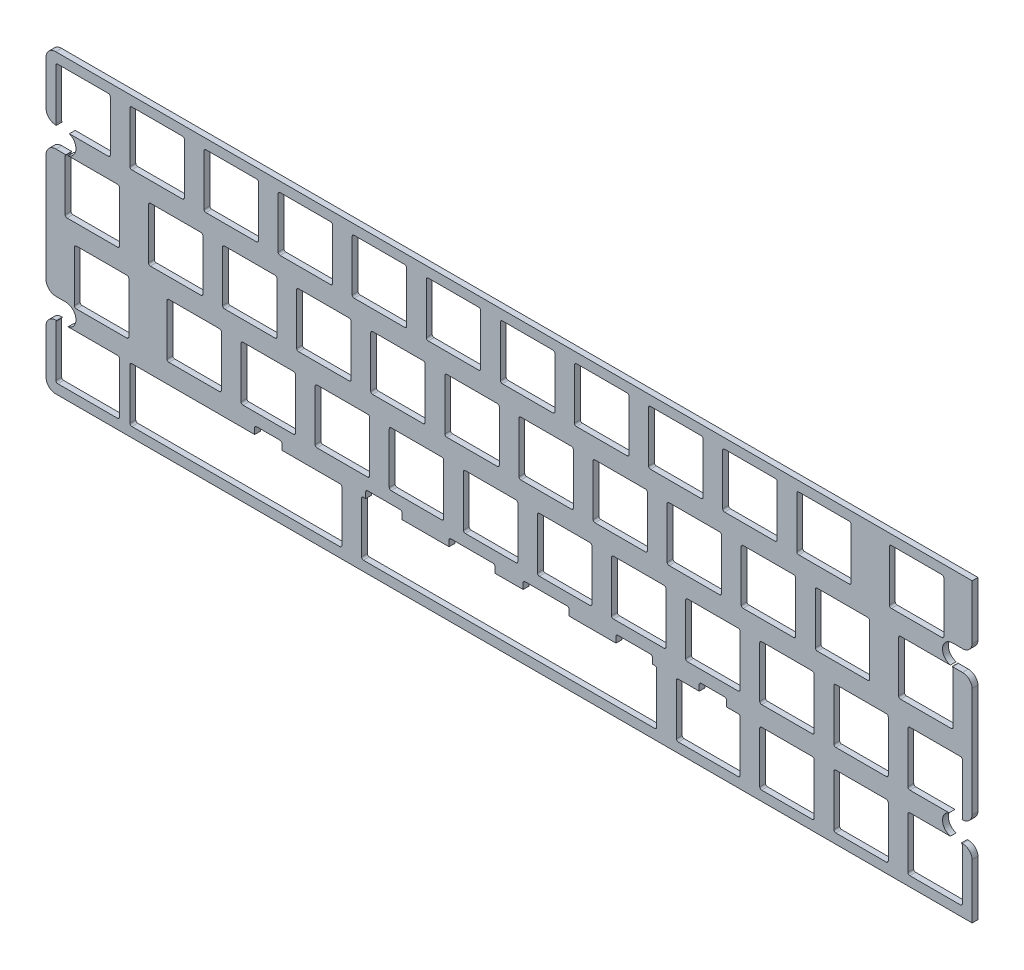
from build123d import *

# Parameters (mm, degrees)
BOSS_EXTRUDE1_DEPTH = 1.5
CUT_EXTRUDE1_DEPTH  = 1.5


with BuildPart() as part:
    # Model → Boss-Extrude1 (new body)
    with BuildSketch(Plane.XY):
        with BuildLine():
            Line((238.125, 0), (2.5, 0))
            ThreePointArc((2.5, 0), (0.732233047, -0.732233047), (0, -2.5))
            Line((0, -2.5), (0, -73.7))
            ThreePointArc((0, -73.7), (0.732233047, -75.467766953), (2.5, -76.2))
            Line((2.5, -76.2), (238.125, -76.2))
            Line((238.125, -76.2), (238.125, 0))
        make_face()
        with BuildLine():
            ThreePointArc((2.525, -60.175), (2.671446609, -59.821446609), (3.025, -59.675))
            Line((3.025, -59.675), (5.40625, -59.675))
            Line((5.40625, -59.675), (16.025, -59.675))
            Line((16.025, -59.675), (18.40625, -59.675))
            ThreePointArc((18.40625, -59.675), (18.759803391, -59.821446609), (18.90625, -60.175))
            Line((18.90625, -60.175), (18.90625, -73.175))
            ThreePointArc((18.90625, -73.175), (18.759803391, -73.528553391), (18.40625, -73.675))
            Line((18.40625, -73.675), (16.025, -73.675))
            Line((16.025, -73.675), (5.40625, -73.675))
            Line((5.40625, -73.675), (3.025, -73.675))
            ThreePointArc((3.025, -73.675), (2.671446609, -73.528553391), (2.525, -73.175))
            Line((2.525, -73.175), (2.525, -60.175))
        make_face(mode=Mode.SUBTRACT)
        with BuildLine():
            Line((62.55625, -73.675), (60.175, -73.675))
            Line((60.175, -73.675), (54.125, -73.675))
            Line((54.125, -73.675), (42.21875, -73.675))
            Line((42.21875, -73.675), (41.125, -73.675))
            Line((41.125, -73.675), (35.075, -73.675))
            Line((35.075, -73.675), (29.21875, -73.675))
            Line((29.21875, -73.675), (22.075, -73.675))
            ThreePointArc((22.075, -73.675), (21.721446609, -73.528553391), (21.575, -73.175))
            Line((21.575, -73.175), (21.575, -60.175))
            ThreePointArc((21.575, -60.175), (21.721446609, -59.821446609), (22.075, -59.675))
            Line((22.075, -59.675), (29.21875, -59.675))
            Line((29.21875, -59.675), (35.075, -59.675))
            Line((35.075, -59.675), (41.125, -59.675))
            Line((41.125, -59.675), (42.21875, -59.675))
            Line((42.21875, -59.675), (53.65, -59.675))
            Line((53.65, -59.675), (53.65, -58.175))
            ThreePointArc((53.65, -58.175), (53.796446609, -57.821446609), (54.15, -57.675))
            Line((54.15, -57.675), (60.15, -57.675))
            ThreePointArc((60.15, -57.675), (60.503553391, -57.821446609), (60.65, -58.175))
            Line((60.65, -58.175), (60.65, -59.675))
            Line((60.65, -59.675), (62.55625, -59.675))
            Line((62.55625, -59.675), (73.175, -59.675))
            Line((73.175, -59.675), (75.55625, -59.675))
            ThreePointArc((75.55625, -59.675), (75.909803391, -59.821446609), (76.05625, -60.175))
            Line((76.05625, -60.175), (76.05625, -73.175))
            ThreePointArc((76.05625, -73.175), (75.909803391, -73.528553391), (75.55625, -73.675))
            Line((75.55625, -73.675), (73.175, -73.675))
            Line((73.175, -73.675), (62.55625, -73.675))
        make_face(mode=Mode.SUBTRACT)
        with BuildLine():
            ThreePointArc((7.2875, -41.125), (7.433946609, -40.771446609), (7.7875, -40.625))
            Line((7.7875, -40.625), (20.7875, -40.625))
            ThreePointArc((20.7875, -40.625), (21.141053391, -40.771446609), (21.2875, -41.125))
            Line((21.2875, -41.125), (21.2875, -54.125))
            ThreePointArc((21.2875, -54.125), (21.141053391, -54.478553391), (20.7875, -54.625))
            Line((20.7875, -54.625), (7.7875, -54.625))
            ThreePointArc((7.7875, -54.625), (7.433946609, -54.478553391), (7.2875, -54.125))
            Line((7.2875, -54.125), (7.2875, -41.125))
        make_face(mode=Mode.SUBTRACT)
        with BuildLine():
            ThreePointArc((31.1, -41.125), (31.246446609, -40.771446609), (31.6, -40.625))
            Line((31.6, -40.625), (44.6, -40.625))
            ThreePointArc((44.6, -40.625), (44.953553391, -40.771446609), (45.1, -41.125))
            Line((45.1, -41.125), (45.1, -54.125))
            ThreePointArc((45.1, -54.125), (44.953553391, -54.478553391), (44.6, -54.625))
            Line((44.6, -54.625), (31.6, -54.625))
            ThreePointArc((31.6, -54.625), (31.246446609, -54.478553391), (31.1, -54.125))
            Line((31.1, -54.125), (31.1, -41.125))
        make_face(mode=Mode.SUBTRACT)
        with BuildLine():
            ThreePointArc((50.15, -41.125), (50.296446609, -40.771446609), (50.65, -40.625))
            Line((50.65, -40.625), (63.65, -40.625))
            ThreePointArc((63.65, -40.625), (64.003553391, -40.771446609), (64.15, -41.125))
            Line((64.15, -41.125), (64.15, -54.125))
            ThreePointArc((64.15, -54.125), (64.003553391, -54.478553391), (63.65, -54.625))
            Line((63.65, -54.625), (50.65, -54.625))
            ThreePointArc((50.65, -54.625), (50.296446609, -54.478553391), (50.15, -54.125))
            Line((50.15, -54.125), (50.15, -41.125))
        make_face(mode=Mode.SUBTRACT)
        with BuildLine():
            ThreePointArc((69.2, -41.125), (69.346446609, -40.771446609), (69.7, -40.625))
            Line((69.7, -40.625), (82.7, -40.625))
            ThreePointArc((82.7, -40.625), (83.053553391, -40.771446609), (83.2, -41.125))
            Line((83.2, -41.125), (83.2, -54.125))
            ThreePointArc((83.2, -54.125), (83.053553391, -54.478553391), (82.7, -54.625))
            Line((82.7, -54.625), (69.7, -54.625))
            ThreePointArc((69.7, -54.625), (69.346446609, -54.478553391), (69.2, -54.125))
            Line((69.2, -54.125), (69.2, -41.125))
        make_face(mode=Mode.SUBTRACT)
        with BuildLine():
            ThreePointArc((88.25, -41.125), (88.396446609, -40.771446609), (88.75, -40.625))
            Line((88.75, -40.625), (101.75, -40.625))
            ThreePointArc((101.75, -40.625), (102.103553391, -40.771446609), (102.25, -41.125))
            Line((102.25, -41.125), (102.25, -54.125))
            ThreePointArc((102.25, -54.125), (102.103553391, -54.478553391), (101.75, -54.625))
            Line((101.75, -54.625), (88.75, -54.625))
            ThreePointArc((88.75, -54.625), (88.396446609, -54.478553391), (88.25, -54.125))
            Line((88.25, -54.125), (88.25, -41.125))
        make_face(mode=Mode.SUBTRACT)
        with BuildLine():
            ThreePointArc((107.3, -41.125), (107.446446609, -40.771446609), (107.8, -40.625))
            Line((107.8, -40.625), (120.8, -40.625))
            ThreePointArc((120.8, -40.625), (121.153553391, -40.771446609), (121.3, -41.125))
            Line((121.3, -41.125), (121.3, -54.125))
            ThreePointArc((121.3, -54.125), (121.153553391, -54.478553391), (120.8, -54.625))
            Line((120.8, -54.625), (107.8, -54.625))
            ThreePointArc((107.8, -54.625), (107.446446609, -54.478553391), (107.3, -54.125))
            Line((107.3, -54.125), (107.3, -41.125))
        make_face(mode=Mode.SUBTRACT)
        with BuildLine():
            Line((91.5745, -58.175), (91.5745, -59.675))
            Line((91.5745, -59.675), (93.5125, -59.675))
            Line((93.5125, -59.675), (94.60625, -59.675))
            Line((94.60625, -59.675), (103.6245, -59.675))
            Line((103.6245, -59.675), (103.6245, -58.175))
            ThreePointArc((103.6245, -58.175), (103.770946609, -57.821446609), (104.1245, -57.675))
            Line((104.1245, -57.675), (106.56925, -57.675))
            Line((106.56925, -57.675), (108.9505, -57.675))
            Line((108.9505, -57.675), (110.1245, -57.675))
            Line((110.1245, -57.675), (112.56925, -57.675))
            Line((112.56925, -57.675), (114.9505, -57.675))
            ThreePointArc((114.9505, -57.675), (115.304053391, -57.821446609), (115.4505, -58.175))
            Line((115.4505, -58.175), (115.4505, -59.675))
            Line((115.4505, -59.675), (120.8, -59.675))
            Line((120.8, -59.675), (122.6745, -59.675))
            Line((122.6745, -59.675), (122.6745, -58.175))
            ThreePointArc((122.6745, -58.175), (122.820946609, -57.821446609), (123.1745, -57.675))
            Line((123.1745, -57.675), (125.55575, -57.675))
            Line((125.55575, -57.675), (128.0005, -57.675))
            Line((128.0005, -57.675), (129.1745, -57.675))
            Line((129.1745, -57.675), (131.55575, -57.675))
            Line((131.55575, -57.675), (134.0005, -57.675))
            ThreePointArc((134.0005, -57.675), (134.354053391, -57.821446609), (134.5005, -58.175))
            Line((134.5005, -58.175), (134.5005, -59.675))
            Line((134.5005, -59.675), (143.51875, -59.675))
            Line((143.51875, -59.675), (144.6125, -59.675))
            Line((144.6125, -59.675), (146.5505, -59.675))
            Line((146.5505, -59.675), (146.5505, -58.175))
            ThreePointArc((146.5505, -58.175), (146.696946609, -57.821446609), (147.0505, -57.675))
            Line((147.0505, -57.675), (149.43175, -57.675))
            Line((149.43175, -57.675), (153.0505, -57.675))
            Line((153.0505, -57.675), (155.43175, -57.675))
            ThreePointArc((155.43175, -57.675), (155.785303391, -57.821446609), (155.93175, -58.175))
            Line((155.93175, -58.175), (155.93175, -59.675))
            Line((155.93175, -59.675), (156.51875, -59.675))
            ThreePointArc((156.51875, -59.675), (156.872303391, -59.821446609), (157.01875, -60.175))
            Line((157.01875, -60.175), (157.01875, -73.175))
            ThreePointArc((157.01875, -73.175), (156.872303391, -73.528553391), (156.51875, -73.675))
            Line((156.51875, -73.675), (146.99375, -73.675))
            Line((146.99375, -73.675), (144.6125, -73.675))
            Line((144.6125, -73.675), (143.51875, -73.675))
            Line((143.51875, -73.675), (133.99375, -73.675))
            Line((133.99375, -73.675), (131.6125, -73.675))
            Line((131.6125, -73.675), (125.5625, -73.675))
            Line((125.5625, -73.675), (120.8, -73.675))
            Line((120.8, -73.675), (112.5625, -73.675))
            Line((112.5625, -73.675), (107.8, -73.675))
            Line((107.8, -73.675), (106.5125, -73.675))
            Line((106.5125, -73.675), (104.13125, -73.675))
            Line((104.13125, -73.675), (94.60625, -73.675))
            Line((94.60625, -73.675), (93.5125, -73.675))
            Line((93.5125, -73.675), (91.13125, -73.675))
            Line((91.13125, -73.675), (81.60625, -73.675))
            ThreePointArc((81.60625, -73.675), (81.252696609, -73.528553391), (81.10625, -73.175))
            Line((81.10625, -73.175), (81.10625, -60.175))
            ThreePointArc((81.10625, -60.175), (81.252696609, -59.821446609), (81.60625, -59.675))
            Line((81.60625, -59.675), (82.19325, -59.675))
            Line((82.19325, -59.675), (82.19325, -58.175))
            ThreePointArc((82.19325, -58.175), (82.339696609, -57.821446609), (82.69325, -57.675))
            Line((82.69325, -57.675), (85.0745, -57.675))
            Line((85.0745, -57.675), (88.69325, -57.675))
            Line((88.69325, -57.675), (91.0745, -57.675))
            ThreePointArc((91.0745, -57.675), (91.428053391, -57.821446609), (91.5745, -58.175))
        make_face(mode=Mode.SUBTRACT)
        with BuildLine():
            Line((168.45, -57.675), (174.45, -57.675))
            ThreePointArc((174.45, -57.675), (174.803553391, -57.821446609), (174.95, -58.175))
            Line((174.95, -58.175), (174.95, -59.675))
            Line((174.95, -59.675), (175.56875, -59.675))
            Line((175.56875, -59.675), (177.95, -59.675))
            ThreePointArc((177.95, -59.675), (178.303553391, -59.821446609), (178.45, -60.175))
            Line((178.45, -60.175), (178.45, -73.175))
            ThreePointArc((178.45, -73.175), (178.303553391, -73.528553391), (177.95, -73.675))
            Line((177.95, -73.675), (175.56875, -73.675))
            Line((175.56875, -73.675), (164.95, -73.675))
            Line((164.95, -73.675), (162.56875, -73.675))
            ThreePointArc((162.56875, -73.675), (162.215196609, -73.528553391), (162.06875, -73.175))
            Line((162.06875, -73.175), (162.06875, -60.175))
            ThreePointArc((162.06875, -60.175), (162.215196609, -59.821446609), (162.56875, -59.675))
            Line((162.56875, -59.675), (164.95, -59.675))
            Line((164.95, -59.675), (167.95, -59.675))
            Line((167.95, -59.675), (167.95, -58.175))
            ThreePointArc((167.95, -58.175), (168.096446609, -57.821446609), (168.45, -57.675))
        make_face(mode=Mode.SUBTRACT)
        with BuildLine():
            ThreePointArc((183.5, -60.175), (183.646446609, -59.821446609), (184, -59.675))
            Line((184, -59.675), (197, -59.675))
            ThreePointArc((197, -59.675), (197.353553391, -59.821446609), (197.5, -60.175))
            Line((197.5, -60.175), (197.5, -73.175))
            ThreePointArc((197.5, -73.175), (197.353553391, -73.528553391), (197, -73.675))
            Line((197, -73.675), (184, -73.675))
            ThreePointArc((184, -73.675), (183.646446609, -73.528553391), (183.5, -73.175))
            Line((183.5, -73.175), (183.5, -60.175))
        make_face(mode=Mode.SUBTRACT)
        with BuildLine():
            ThreePointArc((202.55, -60.175), (202.696446609, -59.821446609), (203.05, -59.675))
            Line((203.05, -59.675), (216.05, -59.675))
            ThreePointArc((216.05, -59.675), (216.403553391, -59.821446609), (216.55, -60.175))
            Line((216.55, -60.175), (216.55, -73.175))
            ThreePointArc((216.55, -73.175), (216.403553391, -73.528553391), (216.05, -73.675))
            Line((216.05, -73.675), (203.05, -73.675))
            ThreePointArc((203.05, -73.675), (202.696446609, -73.528553391), (202.55, -73.175))
            Line((202.55, -73.175), (202.55, -60.175))
        make_face(mode=Mode.SUBTRACT)
        with BuildLine():
            ThreePointArc((221.6, -60.175), (221.746446609, -59.821446609), (222.1, -59.675))
            Line((222.1, -59.675), (235.1, -59.675))
            ThreePointArc((235.1, -59.675), (235.453553391, -59.821446609), (235.6, -60.175))
            Line((235.6, -60.175), (235.6, -73.175))
            ThreePointArc((235.6, -73.175), (235.453553391, -73.528553391), (235.1, -73.675))
            Line((235.1, -73.675), (222.1, -73.675))
            ThreePointArc((222.1, -73.675), (221.746446609, -73.528553391), (221.6, -73.175))
            Line((221.6, -73.175), (221.6, -60.175))
        make_face(mode=Mode.SUBTRACT)
        with BuildLine():
            ThreePointArc((126.35, -41.125), (126.496446609, -40.771446609), (126.85, -40.625))
            Line((126.85, -40.625), (139.85, -40.625))
            ThreePointArc((139.85, -40.625), (140.203553391, -40.771446609), (140.35, -41.125))
            Line((140.35, -41.125), (140.35, -54.125))
            ThreePointArc((140.35, -54.125), (140.203553391, -54.478553391), (139.85, -54.625))
            Line((139.85, -54.625), (126.85, -54.625))
            ThreePointArc((126.85, -54.625), (126.496446609, -54.478553391), (126.35, -54.125))
            Line((126.35, -54.125), (126.35, -41.125))
        make_face(mode=Mode.SUBTRACT)
        with BuildLine():
            ThreePointArc((145.4, -41.125), (145.546446609, -40.771446609), (145.9, -40.625))
            Line((145.9, -40.625), (158.9, -40.625))
            ThreePointArc((158.9, -40.625), (159.253553391, -40.771446609), (159.4, -41.125))
            Line((159.4, -41.125), (159.4, -54.125))
            ThreePointArc((159.4, -54.125), (159.253553391, -54.478553391), (158.9, -54.625))
            Line((158.9, -54.625), (145.9, -54.625))
            ThreePointArc((145.9, -54.625), (145.546446609, -54.478553391), (145.4, -54.125))
            Line((145.4, -54.125), (145.4, -41.125))
        make_face(mode=Mode.SUBTRACT)
        with BuildLine():
            ThreePointArc((164.45, -41.125), (164.596446609, -40.771446609), (164.95, -40.625))
            Line((164.95, -40.625), (177.95, -40.625))
            ThreePointArc((177.95, -40.625), (178.303553391, -40.771446609), (178.45, -41.125))
            Line((178.45, -41.125), (178.45, -54.125))
            ThreePointArc((178.45, -54.125), (178.303553391, -54.478553391), (177.95, -54.625))
            Line((177.95, -54.625), (164.95, -54.625))
            ThreePointArc((164.95, -54.625), (164.596446609, -54.478553391), (164.45, -54.125))
            Line((164.45, -54.125), (164.45, -41.125))
        make_face(mode=Mode.SUBTRACT)
        with BuildLine():
            ThreePointArc((183.5, -41.125), (183.646446609, -40.771446609), (184, -40.625))
            Line((184, -40.625), (197, -40.625))
            ThreePointArc((197, -40.625), (197.353553391, -40.771446609), (197.5, -41.125))
            Line((197.5, -41.125), (197.5, -54.125))
            ThreePointArc((197.5, -54.125), (197.353553391, -54.478553391), (197, -54.625))
            Line((197, -54.625), (184, -54.625))
            ThreePointArc((184, -54.625), (183.646446609, -54.478553391), (183.5, -54.125))
            Line((183.5, -54.125), (183.5, -41.125))
        make_face(mode=Mode.SUBTRACT)
        with BuildLine():
            ThreePointArc((202.55, -41.125), (202.696446609, -40.771446609), (203.05, -40.625))
            Line((203.05, -40.625), (216.05, -40.625))
            ThreePointArc((216.05, -40.625), (216.403553391, -40.771446609), (216.55, -41.125))
            Line((216.55, -41.125), (216.55, -54.125))
            ThreePointArc((216.55, -54.125), (216.403553391, -54.478553391), (216.05, -54.625))
            Line((216.05, -54.625), (203.05, -54.625))
            ThreePointArc((203.05, -54.625), (202.696446609, -54.478553391), (202.55, -54.125))
            Line((202.55, -54.125), (202.55, -41.125))
        make_face(mode=Mode.SUBTRACT)
        with BuildLine():
            ThreePointArc((221.6, -41.125), (221.746446609, -40.771446609), (222.1, -40.625))
            Line((222.1, -40.625), (235.1, -40.625))
            ThreePointArc((235.1, -40.625), (235.453553391, -40.771446609), (235.6, -41.125))
            Line((235.6, -41.125), (235.6, -54.125))
            ThreePointArc((235.6, -54.125), (235.453553391, -54.478553391), (235.1, -54.625))
            Line((235.1, -54.625), (222.1, -54.625))
            ThreePointArc((222.1, -54.625), (221.746446609, -54.478553391), (221.6, -54.125))
            Line((221.6, -54.125), (221.6, -41.125))
        make_face(mode=Mode.SUBTRACT)
        with BuildLine():
            ThreePointArc((4.90625, -22.075), (5.052696609, -21.721446609), (5.40625, -21.575))
            Line((5.40625, -21.575), (18.40625, -21.575))
            ThreePointArc((18.40625, -21.575), (18.759803391, -21.721446609), (18.90625, -22.075))
            Line((18.90625, -22.075), (18.90625, -35.075))
            ThreePointArc((18.90625, -35.075), (18.759803391, -35.428553391), (18.40625, -35.575))
            Line((18.40625, -35.575), (5.40625, -35.575))
            ThreePointArc((5.40625, -35.575), (5.052696609, -35.428553391), (4.90625, -35.075))
            Line((4.90625, -35.075), (4.90625, -22.075))
        make_face(mode=Mode.SUBTRACT)
        with BuildLine():
            ThreePointArc((26.3375, -22.075), (26.483946609, -21.721446609), (26.8375, -21.575))
            Line((26.8375, -21.575), (39.8375, -21.575))
            ThreePointArc((39.8375, -21.575), (40.191053391, -21.721446609), (40.3375, -22.075))
            Line((40.3375, -22.075), (40.3375, -35.075))
            ThreePointArc((40.3375, -35.075), (40.191053391, -35.428553391), (39.8375, -35.575))
            Line((39.8375, -35.575), (26.8375, -35.575))
            ThreePointArc((26.8375, -35.575), (26.483946609, -35.428553391), (26.3375, -35.075))
            Line((26.3375, -35.075), (26.3375, -22.075))
        make_face(mode=Mode.SUBTRACT)
        with BuildLine():
            ThreePointArc((45.3875, -22.075), (45.533946609, -21.721446609), (45.8875, -21.575))
            Line((45.8875, -21.575), (58.8875, -21.575))
            ThreePointArc((58.8875, -21.575), (59.241053391, -21.721446609), (59.3875, -22.075))
            Line((59.3875, -22.075), (59.3875, -35.075))
            ThreePointArc((59.3875, -35.075), (59.241053391, -35.428553391), (58.8875, -35.575))
            Line((58.8875, -35.575), (45.8875, -35.575))
            ThreePointArc((45.8875, -35.575), (45.533946609, -35.428553391), (45.3875, -35.075))
            Line((45.3875, -35.075), (45.3875, -22.075))
        make_face(mode=Mode.SUBTRACT)
        with BuildLine():
            ThreePointArc((64.4375, -22.075), (64.583946609, -21.721446609), (64.9375, -21.575))
            Line((64.9375, -21.575), (77.9375, -21.575))
            ThreePointArc((77.9375, -21.575), (78.291053391, -21.721446609), (78.4375, -22.075))
            Line((78.4375, -22.075), (78.4375, -35.075))
            ThreePointArc((78.4375, -35.075), (78.291053391, -35.428553391), (77.9375, -35.575))
            Line((77.9375, -35.575), (64.9375, -35.575))
            ThreePointArc((64.9375, -35.575), (64.583946609, -35.428553391), (64.4375, -35.075))
            Line((64.4375, -35.075), (64.4375, -22.075))
        make_face(mode=Mode.SUBTRACT)
        with BuildLine():
            ThreePointArc((83.4875, -22.075), (83.633946609, -21.721446609), (83.9875, -21.575))
            Line((83.9875, -21.575), (96.9875, -21.575))
            ThreePointArc((96.9875, -21.575), (97.341053391, -21.721446609), (97.4875, -22.075))
            Line((97.4875, -22.075), (97.4875, -35.075))
            ThreePointArc((97.4875, -35.075), (97.341053391, -35.428553391), (96.9875, -35.575))
            Line((96.9875, -35.575), (83.9875, -35.575))
            ThreePointArc((83.9875, -35.575), (83.633946609, -35.428553391), (83.4875, -35.075))
            Line((83.4875, -35.075), (83.4875, -22.075))
        make_face(mode=Mode.SUBTRACT)
        with BuildLine():
            ThreePointArc((102.5375, -22.075), (102.683946609, -21.721446609), (103.0375, -21.575))
            Line((103.0375, -21.575), (116.0375, -21.575))
            ThreePointArc((116.0375, -21.575), (116.391053391, -21.721446609), (116.5375, -22.075))
            Line((116.5375, -22.075), (116.5375, -35.075))
            ThreePointArc((116.5375, -35.075), (116.391053391, -35.428553391), (116.0375, -35.575))
            Line((116.0375, -35.575), (103.0375, -35.575))
            ThreePointArc((103.0375, -35.575), (102.683946609, -35.428553391), (102.5375, -35.075))
            Line((102.5375, -35.075), (102.5375, -22.075))
        make_face(mode=Mode.SUBTRACT)
        with BuildLine():
            ThreePointArc((2.525, -3.025), (2.671446609, -2.671446609), (3.025, -2.525))
            Line((3.025, -2.525), (16.025, -2.525))
            ThreePointArc((16.025, -2.525), (16.378553391, -2.671446609), (16.525, -3.025))
            Line((16.525, -3.025), (16.525, -16.025))
            ThreePointArc((16.525, -16.025), (16.378553391, -16.378553391), (16.025, -16.525))
            Line((16.025, -16.525), (3.025, -16.525))
            ThreePointArc((3.025, -16.525), (2.671446609, -16.378553391), (2.525, -16.025))
            Line((2.525, -16.025), (2.525, -3.025))
        make_face(mode=Mode.SUBTRACT)
        with BuildLine():
            ThreePointArc((21.575, -3.025), (21.721446609, -2.671446609), (22.075, -2.525))
            Line((22.075, -2.525), (35.075, -2.525))
            ThreePointArc((35.075, -2.525), (35.428553391, -2.671446609), (35.575, -3.025))
            Line((35.575, -3.025), (35.575, -16.025))
            ThreePointArc((35.575, -16.025), (35.428553391, -16.378553391), (35.075, -16.525))
            Line((35.075, -16.525), (22.075, -16.525))
            ThreePointArc((22.075, -16.525), (21.721446609, -16.378553391), (21.575, -16.025))
            Line((21.575, -16.025), (21.575, -3.025))
        make_face(mode=Mode.SUBTRACT)
        with BuildLine():
            ThreePointArc((40.625, -3.025), (40.771446609, -2.671446609), (41.125, -2.525))
            Line((41.125, -2.525), (54.125, -2.525))
            ThreePointArc((54.125, -2.525), (54.478553391, -2.671446609), (54.625, -3.025))
            Line((54.625, -3.025), (54.625, -16.025))
            ThreePointArc((54.625, -16.025), (54.478553391, -16.378553391), (54.125, -16.525))
            Line((54.125, -16.525), (41.125, -16.525))
            ThreePointArc((41.125, -16.525), (40.771446609, -16.378553391), (40.625, -16.025))
            Line((40.625, -16.025), (40.625, -3.025))
        make_face(mode=Mode.SUBTRACT)
        with BuildLine():
            ThreePointArc((59.675, -3.025), (59.821446609, -2.671446609), (60.175, -2.525))
            Line((60.175, -2.525), (73.175, -2.525))
            ThreePointArc((73.175, -2.525), (73.528553391, -2.671446609), (73.675, -3.025))
            Line((73.675, -3.025), (73.675, -16.025))
            ThreePointArc((73.675, -16.025), (73.528553391, -16.378553391), (73.175, -16.525))
            Line((73.175, -16.525), (60.175, -16.525))
            ThreePointArc((60.175, -16.525), (59.821446609, -16.378553391), (59.675, -16.025))
            Line((59.675, -16.025), (59.675, -3.025))
        make_face(mode=Mode.SUBTRACT)
        with BuildLine():
            ThreePointArc((78.725, -3.025), (78.871446609, -2.671446609), (79.225, -2.525))
            Line((79.225, -2.525), (92.225, -2.525))
            ThreePointArc((92.225, -2.525), (92.578553391, -2.671446609), (92.725, -3.025))
            Line((92.725, -3.025), (92.725, -16.025))
            ThreePointArc((92.725, -16.025), (92.578553391, -16.378553391), (92.225, -16.525))
            Line((92.225, -16.525), (79.225, -16.525))
            ThreePointArc((79.225, -16.525), (78.871446609, -16.378553391), (78.725, -16.025))
            Line((78.725, -16.025), (78.725, -3.025))
        make_face(mode=Mode.SUBTRACT)
        with BuildLine():
            ThreePointArc((97.775, -3.025), (97.921446609, -2.671446609), (98.275, -2.525))
            Line((98.275, -2.525), (111.275, -2.525))
            ThreePointArc((111.275, -2.525), (111.628553391, -2.671446609), (111.775, -3.025))
            Line((111.775, -3.025), (111.775, -16.025))
            ThreePointArc((111.775, -16.025), (111.628553391, -16.378553391), (111.275, -16.525))
            Line((111.275, -16.525), (98.275, -16.525))
            ThreePointArc((98.275, -16.525), (97.921446609, -16.378553391), (97.775, -16.025))
            Line((97.775, -16.025), (97.775, -3.025))
        make_face(mode=Mode.SUBTRACT)
        with BuildLine():
            ThreePointArc((121.5875, -22.075), (121.733946609, -21.721446609), (122.0875, -21.575))
            Line((122.0875, -21.575), (135.0875, -21.575))
            ThreePointArc((135.0875, -21.575), (135.441053391, -21.721446609), (135.5875, -22.075))
            Line((135.5875, -22.075), (135.5875, -35.075))
            ThreePointArc((135.5875, -35.075), (135.441053391, -35.428553391), (135.0875, -35.575))
            Line((135.0875, -35.575), (122.0875, -35.575))
            ThreePointArc((122.0875, -35.575), (121.733946609, -35.428553391), (121.5875, -35.075))
            Line((121.5875, -35.075), (121.5875, -22.075))
        make_face(mode=Mode.SUBTRACT)
        with BuildLine():
            ThreePointArc((140.6375, -22.075), (140.783946609, -21.721446609), (141.1375, -21.575))
            Line((141.1375, -21.575), (154.1375, -21.575))
            ThreePointArc((154.1375, -21.575), (154.491053391, -21.721446609), (154.6375, -22.075))
            Line((154.6375, -22.075), (154.6375, -35.075))
            ThreePointArc((154.6375, -35.075), (154.491053391, -35.428553391), (154.1375, -35.575))
            Line((154.1375, -35.575), (141.1375, -35.575))
            ThreePointArc((141.1375, -35.575), (140.783946609, -35.428553391), (140.6375, -35.075))
            Line((140.6375, -35.075), (140.6375, -22.075))
        make_face(mode=Mode.SUBTRACT)
        with BuildLine():
            ThreePointArc((159.6875, -22.075), (159.833946609, -21.721446609), (160.1875, -21.575))
            Line((160.1875, -21.575), (173.1875, -21.575))
            ThreePointArc((173.1875, -21.575), (173.541053391, -21.721446609), (173.6875, -22.075))
            Line((173.6875, -22.075), (173.6875, -35.075))
            ThreePointArc((173.6875, -35.075), (173.541053391, -35.428553391), (173.1875, -35.575))
            Line((173.1875, -35.575), (160.1875, -35.575))
            ThreePointArc((160.1875, -35.575), (159.833946609, -35.428553391), (159.6875, -35.075))
            Line((159.6875, -35.075), (159.6875, -22.075))
        make_face(mode=Mode.SUBTRACT)
        with BuildLine():
            ThreePointArc((178.7375, -22.075), (178.883946609, -21.721446609), (179.2375, -21.575))
            Line((179.2375, -21.575), (192.2375, -21.575))
            ThreePointArc((192.2375, -21.575), (192.591053391, -21.721446609), (192.7375, -22.075))
            Line((192.7375, -22.075), (192.7375, -35.075))
            ThreePointArc((192.7375, -35.075), (192.591053391, -35.428553391), (192.2375, -35.575))
            Line((192.2375, -35.575), (179.2375, -35.575))
            ThreePointArc((179.2375, -35.575), (178.883946609, -35.428553391), (178.7375, -35.075))
            Line((178.7375, -35.075), (178.7375, -22.075))
        make_face(mode=Mode.SUBTRACT)
        with BuildLine():
            ThreePointArc((197.7875, -22.075), (197.933946609, -21.721446609), (198.2875, -21.575))
            Line((198.2875, -21.575), (211.2875, -21.575))
            ThreePointArc((211.2875, -21.575), (211.641053391, -21.721446609), (211.7875, -22.075))
            Line((211.7875, -22.075), (211.7875, -35.075))
            ThreePointArc((211.7875, -35.075), (211.641053391, -35.428553391), (211.2875, -35.575))
            Line((211.2875, -35.575), (198.2875, -35.575))
            ThreePointArc((198.2875, -35.575), (197.933946609, -35.428553391), (197.7875, -35.075))
            Line((197.7875, -35.075), (197.7875, -22.075))
        make_face(mode=Mode.SUBTRACT)
        with BuildLine():
            ThreePointArc((219.21875, -22.075), (219.365196609, -21.721446609), (219.71875, -21.575))
            Line((219.71875, -21.575), (232.71875, -21.575))
            ThreePointArc((232.71875, -21.575), (233.072303391, -21.721446609), (233.21875, -22.075))
            Line((233.21875, -22.075), (233.21875, -35.075))
            ThreePointArc((233.21875, -35.075), (233.072303391, -35.428553391), (232.71875, -35.575))
            Line((232.71875, -35.575), (219.71875, -35.575))
            ThreePointArc((219.71875, -35.575), (219.365196609, -35.428553391), (219.21875, -35.075))
            Line((219.21875, -35.075), (219.21875, -22.075))
        make_face(mode=Mode.SUBTRACT)
        with BuildLine():
            ThreePointArc((116.825, -3.025), (116.971446609, -2.671446609), (117.325, -2.525))
            Line((117.325, -2.525), (130.325, -2.525))
            ThreePointArc((130.325, -2.525), (130.678553391, -2.671446609), (130.825, -3.025))
            Line((130.825, -3.025), (130.825, -16.025))
            ThreePointArc((130.825, -16.025), (130.678553391, -16.378553391), (130.325, -16.525))
            Line((130.325, -16.525), (117.325, -16.525))
            ThreePointArc((117.325, -16.525), (116.971446609, -16.378553391), (116.825, -16.025))
            Line((116.825, -16.025), (116.825, -3.025))
        make_face(mode=Mode.SUBTRACT)
        with BuildLine():
            ThreePointArc((135.875, -3.025), (136.021446609, -2.671446609), (136.375, -2.525))
            Line((136.375, -2.525), (149.375, -2.525))
            ThreePointArc((149.375, -2.525), (149.728553391, -2.671446609), (149.875, -3.025))
            Line((149.875, -3.025), (149.875, -16.025))
            ThreePointArc((149.875, -16.025), (149.728553391, -16.378553391), (149.375, -16.525))
            Line((149.375, -16.525), (136.375, -16.525))
            ThreePointArc((136.375, -16.525), (136.021446609, -16.378553391), (135.875, -16.025))
            Line((135.875, -16.025), (135.875, -3.025))
        make_face(mode=Mode.SUBTRACT)
        with BuildLine():
            ThreePointArc((154.925, -3.025), (155.071446609, -2.671446609), (155.425, -2.525))
            Line((155.425, -2.525), (168.425, -2.525))
            ThreePointArc((168.425, -2.525), (168.778553391, -2.671446609), (168.925, -3.025))
            Line((168.925, -3.025), (168.925, -16.025))
            ThreePointArc((168.925, -16.025), (168.778553391, -16.378553391), (168.425, -16.525))
            Line((168.425, -16.525), (155.425, -16.525))
            ThreePointArc((155.425, -16.525), (155.071446609, -16.378553391), (154.925, -16.025))
            Line((154.925, -16.025), (154.925, -3.025))
        make_face(mode=Mode.SUBTRACT)
        with BuildLine():
            ThreePointArc((173.975, -3.025), (174.121446609, -2.671446609), (174.475, -2.525))
            Line((174.475, -2.525), (187.475, -2.525))
            ThreePointArc((187.475, -2.525), (187.828553391, -2.671446609), (187.975, -3.025))
            Line((187.975, -3.025), (187.975, -16.025))
            ThreePointArc((187.975, -16.025), (187.828553391, -16.378553391), (187.475, -16.525))
            Line((187.475, -16.525), (174.475, -16.525))
            ThreePointArc((174.475, -16.525), (174.121446609, -16.378553391), (173.975, -16.025))
            Line((173.975, -16.025), (173.975, -3.025))
        make_face(mode=Mode.SUBTRACT)
        with BuildLine():
            ThreePointArc((193.025, -3.025), (193.171446609, -2.671446609), (193.525, -2.525))
            Line((193.525, -2.525), (206.525, -2.525))
            ThreePointArc((206.525, -2.525), (206.878553391, -2.671446609), (207.025, -3.025))
            Line((207.025, -3.025), (207.025, -16.025))
            ThreePointArc((207.025, -16.025), (206.878553391, -16.378553391), (206.525, -16.525))
            Line((206.525, -16.525), (193.525, -16.525))
            ThreePointArc((193.525, -16.525), (193.171446609, -16.378553391), (193.025, -16.025))
            Line((193.025, -16.025), (193.025, -3.025))
        make_face(mode=Mode.SUBTRACT)
        with BuildLine():
            ThreePointArc((216.8375, -3.025), (216.983946609, -2.671446609), (217.3375, -2.525))
            Line((217.3375, -2.525), (230.3375, -2.525))
            ThreePointArc((230.3375, -2.525), (230.691053391, -2.671446609), (230.8375, -3.025))
            Line((230.8375, -3.025), (230.8375, -16.025))
            ThreePointArc((230.8375, -16.025), (230.691053391, -16.378553391), (230.3375, -16.525))
            Line((230.3375, -16.525), (217.3375, -16.525))
            ThreePointArc((217.3375, -16.525), (216.983946609, -16.378553391), (216.8375, -16.025))
            Line((216.8375, -16.025), (216.8375, -3.025))
        make_face(mode=Mode.SUBTRACT)
    extrude(amount=BOSS_EXTRUDE1_DEPTH)

    # Sketch2 → Cut-Extrude1 (cut)
    with BuildSketch(Plane.XY.offset(1.5)):
        with BuildLine():
            Line((5.05, -16.35), (2.55, -16.35))
            ThreePointArc((2.55, -16.35), (0.746877708, -15.603122292), (0, -13.8))
            Line((0, -13.8), (0, -24.2))
            ThreePointArc((0, -24.2), (0.746877708, -22.396877708), (2.55, -21.65))
            Line((2.55, -21.65), (5.05, -21.65))
            ThreePointArc((5.05, -21.65), (7.7, -19), (5.05, -16.35))
        make_face()
        with BuildLine():
            Line((5.05, -54.45), (2.55, -54.45))
            ThreePointArc((2.55, -54.45), (0.746877708, -53.703122292), (0, -51.9))
            Line((0, -51.9), (0, -62.3))
            ThreePointArc((0, -62.3), (0.746877708, -60.496877708), (2.55, -59.75))
            Line((2.55, -59.75), (5.05, -59.75))
            ThreePointArc((5.05, -59.75), (7.7, -57.1), (5.05, -54.45))
        make_face()
        with BuildLine():
            Line((233.15, -59.75), (235.65, -59.75))
            ThreePointArc((235.65, -59.75), (237.347063067, -60.421581645), (238.125, -62.072599238))
            Line((238.125, -62.072599238), (238.125, -52.127400762))
            ThreePointArc((238.125, -52.127400762), (237.347063067, -53.778418355), (235.65, -54.45))
            Line((235.65, -54.45), (233.15, -54.45))
            ThreePointArc((233.15, -54.45), (230.5, -57.1), (233.15, -59.75))
        make_face()
        with BuildLine():
            Line((233.15, -21.65), (235.65, -21.65))
            ThreePointArc((235.65, -21.65), (237.347063067, -22.321581645), (238.125, -23.972599238))
            Line((238.125, -23.972599238), (238.125, -14.027400762))
            ThreePointArc((238.125, -14.027400762), (237.347063067, -15.678418355), (235.65, -16.35))
            Line((235.65, -16.35), (233.15, -16.35))
            ThreePointArc((233.15, -16.35), (230.5, -19), (233.15, -21.65))
        make_face()
    extrude(amount=-CUT_EXTRUDE1_DEPTH, mode=Mode.SUBTRACT)


solid = part.part
